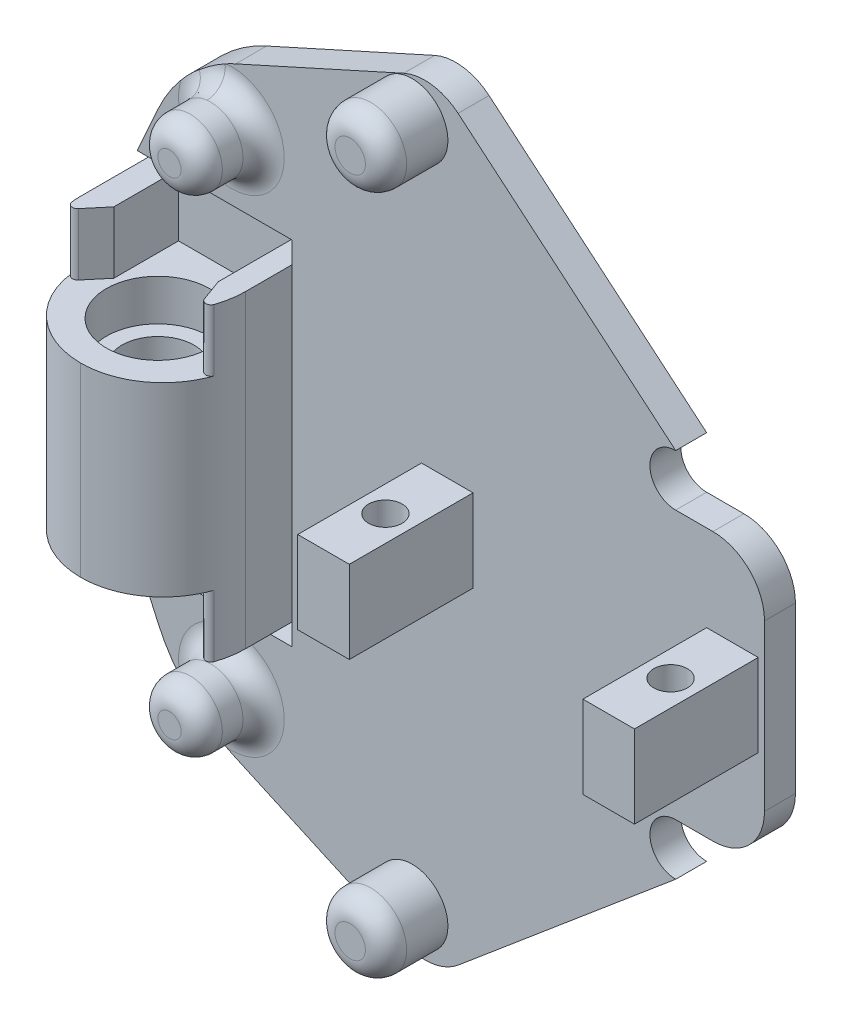
from build123d import *
from build123d.topology import SkipClean

# Parameters (mm, degrees)
CROQUIS3_R                = 2.075
CROQUIS3_R_2              = 1.625
SALIENTE_EXTRUIR1_DEPTH   = 3
CROQUIS5_W                = 5
CROQUIS5_H                = 8
SALIENTE_EXTRUIR2_DEPTH   = 12
CROQUIS6_R                = 1.625
CORTAR_EXTRUIR1_DEPTH     = 7
SALIENTE_EXTRUIR4_START   = 4
CROQUIS10_R               = 3.125
CROQUIS10_R_2             = 1.625
CROQUIS10_R_3             = 3.475
CROQUIS10_R_4             = 2.075
SALIENTE_EXTRUIR4_DEPTH   = 4
SALIENTE_EXTRUIR5_START   = 2
CROQUIS11_R               = 3.125
CROQUIS11_R_2             = 3.475
SALIENTE_EXTRUIR5_DEPTH   = 2
REDONDEO3_R               = 2
REDONDEO3_OF_SIMETR_A2_R  = 2
REDONDEO4_R               = 15
REDONDEO5_R               = 5
SALIENTE_EXTRUIR6_DEPTH   = 2.5
CORTAR_EXTRUIR5_DEPTH     = 2.5
CROQUIS16_W               = 16
CROQUIS16_H               = 18
SALIENTE_EXTRUIR7_DEPTH   = 15
CROQUIS8_R                = 5
CORTAR_EXTRUIR2_DEPTH     = 4
CORTAR_EXTRUIR3_START     = -14
CROQUIS8_2_R              = 5
CORTAR_EXTRUIR3_DEPTH     = 4
CROQUIS12_R               = 3.5
CORTAR_EXTRUIR4_DEPTH     = 10
REDONDEO6_R               = 8
SALIENTE_EXTRUIR8_DEPTH   = 6
REDONDEO10_R              = 0.5
REDONDEO10_OF_SIMETR_A3_R = 0.5


# Some blends are built 0.0001 mm under size
with BuildPart() as part:
    # Croquis3 → Saliente-Extruir1 (new body)
    with BuildSketch(Plane.XY):
        with BuildLine():
            Line((-4.208716739, 39.036604707), (-27.718733391, 58.828362176))
            Line((-27.718733391, 58.828362176), (-52.069504728, 47.828251475))
            Line((-52.069504728, 47.828251475), (-64.068802802, 21.036604802))
            Line((-64.068802802, 21.036604802), (-52.069504728, -5.75504187))
            Line((-52.069504728, -5.75504187), (-27.718733391, -16.755152571))
            Line((-27.718733391, -16.755152571), (-4.208716739, 3.036604898))
            ThreePointArc((-4.208716739, 3.036604898), (-6.708716739, 5.536604898), (-4.208716739, 8.036604898))
            Line((-4.208716739, 8.036604898), (4.399490704, 8.036604898))
            Line((4.399490704, 8.036604898), (4.399490704, 34.036604707))
            Line((4.399490704, 34.036604707), (-4.208716739, 34.036604707))
            ThreePointArc((-4.208716739, 34.036604707), (-6.708716739, 36.536604707), (-4.208716739, 39.036604707))
        make_face()
        with Locations((-29.772203367, 54.02119887)):
            Circle(CROQUIS3_R, mode=Mode.SUBTRACT)
        with Locations((-47.293421877, 44.62288951)):
            Circle(CROQUIS3_R_2, mode=Mode.SUBTRACT)
        with Locations(Location((-47.293421877, -2.549679905, 0), (0, 0, 180))):
            Circle(CROQUIS3_R_2, mode=Mode.SUBTRACT)
        with Locations(Location((-29.772203367, -11.947989265, 0), (0, 0, 180))):
            Circle(CROQUIS3_R, mode=Mode.SUBTRACT)
    extrude(amount=-SALIENTE_EXTRUIR1_DEPTH)

    # Croquis5 → Saliente-Extruir2 (add)
    with BuildSketch(Plane.XY):
        with Locations((-26.358716739, 21.661604802)):
            Rectangle(CROQUIS5_W, CROQUIS5_H)
        with Locations((1.291283261, 21.661604802)):
            Rectangle(CROQUIS5_W, CROQUIS5_H)
    extrude(amount=SALIENTE_EXTRUIR2_DEPTH)

    # Croquis6 → Cortar-Extruir1 (cut)
    with BuildSketch(Plane(origin=(0, 25.661604802, 0), x_dir=(1, 0, 0), z_dir=(0, 1, 0))):
        with Locations(Location((-26.358716739, -6, 0), (0, 0, 180))):
            Circle(CROQUIS6_R)
        with Locations((1.291283261, -6)):
            Circle(CROQUIS6_R)
    extrude(amount=-CORTAR_EXTRUIR1_DEPTH, mode=Mode.SUBTRACT)

    # Croquis10 → Saliente-Extruir4 (add)
    # profile 1 of 2: a face of its own
    with BuildSketch(Plane.XY.offset(SALIENTE_EXTRUIR4_START)):
        with Locations((-47.293421877, 44.62288951)):
            Circle(CROQUIS10_R)
        with Locations((-47.293421877, 44.62288951)):
            Circle(CROQUIS10_R_2, mode=Mode.SUBTRACT)
    # profile 2 of 2: a face of its own
    with BuildSketch(Plane.XY.offset(SALIENTE_EXTRUIR4_START)):
        with Locations((-29.772203367, 54.02119887)):
            Circle(CROQUIS10_R_3)
        with Locations((-29.772203367, 54.02119887)):
            Circle(CROQUIS10_R_4, mode=Mode.SUBTRACT)
    saliente_extruir4 = extrude(amount=-SALIENTE_EXTRUIR4_DEPTH)

    # Croquis11 → Saliente-Extruir5 (add)
    with BuildSketch(Plane.XY.offset(4).offset(SALIENTE_EXTRUIR5_START)):
        with Locations((-47.293421877, 44.62288951)):
            Circle(CROQUIS11_R)
        with Locations((-29.772203367, 54.02119887)):
            Circle(CROQUIS11_R_2)
    saliente_extruir5 = extrude(amount=-SALIENTE_EXTRUIR5_DEPTH)

    # Redondeo3
    redondeo3_edges = [part.edges().sort_by_distance(p)[0] for p in [
        (-33.247203367, 54.02119887, 6),
        (-50.418421877, 44.62288951, 0),
        (-50.418421877, 44.62288951, 6),
    ]]
    fillet(redondeo3_edges, radius=REDONDEO3_R)

    # Simetría2: Saliente-Extruir4, Saliente-Extruir5 across plane
    add(saliente_extruir4.mirror(Plane(origin=(0, 21.036604802, 0), x_dir=(0, 0, 1), z_dir=(0, -1, 0))))
    add(saliente_extruir5.mirror(Plane(origin=(0, 21.036604802, 0), x_dir=(0, 0, 1), z_dir=(0, -1, 0))))

    # Redondeo3 of Simetría2
    redondeo3_of_simetr_a2_edges = [part.edges().sort_by_distance(p)[0] for p in [
        (-33.247203367, -11.947989265, 6),
        (-50.418421877, -2.549679905, 0),
        (-50.418421877, -2.549679905, 6),
    ]]
    fillet(redondeo3_of_simetr_a2_edges, radius=REDONDEO3_OF_SIMETR_A2_R)

    # Redondeo4
    # the kernel refuses this fillet: 15 mm, written as the material it takes off along each edge
    with BuildSketch(Plane(origin=(-52.069504728, -5.75504187, 14.231140734), x_dir=(-0.4087509488611458, 0.9126459673965106, 0), z_dir=(0, 0, -1))) as redondeo4_piece_1:
        with BuildLine():
            CenterArc((REDONDEO4_R * 0.379497086232, REDONDEO4_R), REDONDEO4_R, 228.436784363, 41.563215637)
            Line((-REDONDEO4_R * 0.283948897091, REDONDEO4_R * 0.251775817543), (0, 0))
            Line((0, 0), (REDONDEO4_R * 0.379497086232, 0))
        make_face()
    extrude(amount=31.462281467, mode=Mode.SUBTRACT)
    with BuildSketch(Plane(origin=(-64.068802802, 21.036604802, 16.795297552), x_dir=(0.40875094886114643, -0.9126459673965104, 0), z_dir=(0, 0, -1))) as redondeo4_piece_2:
        with BuildLine():
            CenterArc((REDONDEO4_R * 0.447874601394, -REDONDEO4_R), REDONDEO4_R, 90, 48.252790965)
            Line((-REDONDEO4_R * 0.298215208902, -REDONDEO4_R * 0.33415467639), (0, 0))
            Line((0, 0), (REDONDEO4_R * 0.447874601394, 0))
        make_face()
    extrude(amount=36.590595105, mode=Mode.SUBTRACT)
    with BuildSketch(Plane(origin=(-52.069504728, 47.828251475, 14.231140734), x_dir=(-0.40875094886114616, -0.9126459673965105, 0), z_dir=(0, 0, -1))) as redondeo4_piece_3:
        with BuildLine():
            CenterArc((REDONDEO4_R * 0.379497086232, -REDONDEO4_R), REDONDEO4_R, 90, 41.563215637)
            Line((-REDONDEO4_R * 0.283948897091, -REDONDEO4_R * 0.251775817543), (0, 0))
            Line((0, 0), (REDONDEO4_R * 0.379497086232, 0))
        make_face()
    extrude(amount=31.462281467, mode=Mode.SUBTRACT)

    # Redondeo5
    redondeo5_edges = [part.edges().sort_by_distance(p)[0] for p in [
        (4.399490704, 34.036604707, -1.5),
        (4.399490704, 8.036604898, -1.5),
        (-27.718733391, -16.755152571, -1.5),
        (-27.718733391, 58.828362176, -1.5),
    ]]
    fillet(redondeo5_edges, radius=REDONDEO5_R)

    # Croquis14 → Saliente-Extruir6 (add)
    with SkipClean():  # the faces are left unmerged after this step: merging them gives an invalid solid
        with BuildSketch(Plane(origin=(0, 0, -3), x_dir=(-1, 0, 0), z_dir=(0, 0, -1))):
            with BuildLine():
                Line((53.018309819, -2.99725003), (51.651307757, 0.028860824))
                ThreePointArc((51.651307757, 0.028860824), (50.491277609, 1.09254301), (48.920900738, 0.987632471))
                ThreePointArc((48.920900738, 0.987632471), (16.208716279, 21.036604736), (48.920900752, 41.085576979))
                ThreePointArc((48.920900752, 41.085576979), (50.491277623, 40.980666438), (51.651307772, 42.044348625))
                Line((51.651307772, 42.044348625), (53.018309871, 45.07045956))
                ThreePointArc((53.018309871, 45.07045956), (53.764302238, 43.883979947), (54.396301639, 42.633054194))
                Line((54.396301639, 42.633054194), (61.322765277, 27.167869035))
                ThreePointArc((61.322765277, 27.167869035), (62.633075767, 21.036604802), (61.322765277, 14.90534057))
                Line((61.322765277, 14.90534057), (54.396301639, -0.559844589))
                ThreePointArc((54.396301639, -0.559844589), (53.764302216, -1.810770382), (53.018309819, -2.99725003))
            make_face()
        extrude(amount=SALIENTE_EXTRUIR6_DEPTH)

    # Croquis15 → Cortar-Extruir5 (cut)
    with SkipClean():  # the faces are left unmerged after this step: merging them gives an invalid solid
        with BuildSketch(Plane.XY):
            with BuildLine():
                Line((-61.322765277, 14.90534057), (-56.417753891, 3.953588961))
                Line((-56.417753891, 3.953588961), (-41.417753891, 3.953588961))
                Line((-41.417753891, 3.953588961), (-41.417753891, 38.119620644))
                Line((-41.417753891, 38.119620644), (-56.417753891, 38.119620644))
                Line((-56.417753891, 38.119620644), (-61.322765277, 27.167869035))
                ThreePointArc((-61.322765277, 27.167869035), (-62.633075767, 21.036604802), (-61.322765277, 14.90534057))
            make_face()
        extrude(amount=-CORTAR_EXTRUIR5_DEPTH, mode=Mode.SUBTRACT)

    # Croquis16 → Saliente-Extruir7 (add)
    with SkipClean():  # the faces are left unmerged after this step: merging them gives an invalid solid
        with BuildSketch(Plane.XY.offset(-2.5)):
            with Locations((-49.417753891, 21.036604802)):
                Rectangle(CROQUIS16_W, CROQUIS16_H)
        extrude(amount=SALIENTE_EXTRUIR7_DEPTH)

    # Croquis8 → Cortar-Extruir2 (cut)
    with SkipClean():  # the faces are left unmerged after this step: merging them gives an invalid solid
        with BuildSketch(Plane.XZ.offset(-12.036604802)):
            with Locations(Location((-49.417753891, 5, 0), (0, 0, 270))):
                Circle(CROQUIS8_R)
        extrude(amount=-CORTAR_EXTRUIR2_DEPTH, mode=Mode.SUBTRACT)

    # Croquis8<2> → Cortar-Extruir3 (cut)
    with SkipClean():  # the faces are left unmerged after this step: merging them gives an invalid solid
        with BuildSketch(Plane.XZ.offset(-12.036604802).offset(CORTAR_EXTRUIR3_START)):
            with Locations(Location((-49.417753891, 5, 0), (0, 0, 270))):
                Circle(CROQUIS8_2_R)
        extrude(amount=-CORTAR_EXTRUIR3_DEPTH, mode=Mode.SUBTRACT)

    # Croquis12 → Cortar-Extruir4 (cut)
    with SkipClean():  # the faces are left unmerged after this step: merging them gives an invalid solid
        with BuildSketch(Plane.XZ.offset(-16.036604802)):
            with Locations(Location((-49.417753891, 5, 0), (0, 0, 270))):
                Circle(CROQUIS12_R)
        extrude(amount=-CORTAR_EXTRUIR4_DEPTH, mode=Mode.SUBTRACT)

    # Redondeo6
    redondeo6_edges = [part.edges().sort_by_distance(p)[0] for p in [
        (-41.417753891, 21.036604802, 12.5),
        (-57.417753891, 21.036604802, 12.5),
    ]]
    fillet(redondeo6_edges, radius=REDONDEO6_R - 0.0001)  # a hair under: the kernel refuses the full size

    # Croquis17 → Saliente-Extruir8 (add)
    with BuildSketch(Plane.XZ.offset(-12.036604802)):
        with BuildLine():
            Line((-54.917753891, 3.776025625), (-54.917753891, -2.5))
            Line((-54.917753891, -2.5), (-57.417753891, -2.5))
            Line((-57.417753891, -2.5), (-57.417753891, 4.5))
            ThreePointArc((-57.417753891, 4.5), (-57.356328969, 5.489457291), (-57.172997458, 6.463720248))
            Line((-57.172997458, 6.463720248), (-54.917753891, 3.776025625))
        make_face()
        with BuildLine():
            Line((-41.417753891, 4.5), (-41.417753891, -2.5))
            Line((-41.417753891, -2.5), (-43.564776143, -2.5))
            Line((-43.564776143, -2.5), (-43.564776143, 5))
            Line((-43.564776143, 5), (-42.369399545, 8.284270209))
            ThreePointArc((-42.369399545, 8.284270209), (-41.659312206, 6.451046544), (-41.417753891, 4.5))
        make_face()
    saliente_extruir8 = extrude(amount=SALIENTE_EXTRUIR8_DEPTH)

    # Redondeo10
    redondeo10_edges = [part.edges().sort_by_distance(p)[0] for p in [
        (-57.172997458, 9.036604802, 6.463720248),
        (-42.369399545, 9.036604802, 8.284270209),
    ]]
    fillet(redondeo10_edges, radius=REDONDEO10_R)

    # Simetría3: Saliente-Extruir8 across plane
    add(saliente_extruir8.mirror(Plane(origin=(0, 21.036604802, 0), x_dir=(0, 0, 1), z_dir=(0, -1, 0))))

    # Redondeo10 of Simetría3
    redondeo10_of_simetr_a3_edges = [part.edges().sort_by_distance(p)[0] for p in [
        (-57.172997458, 33.036604802, 6.463720248),
        (-42.369399545, 33.036604802, 8.284270209),
    ]]
    fillet(redondeo10_of_simetr_a3_edges, radius=REDONDEO10_OF_SIMETR_A3_R)


solid = part.part
